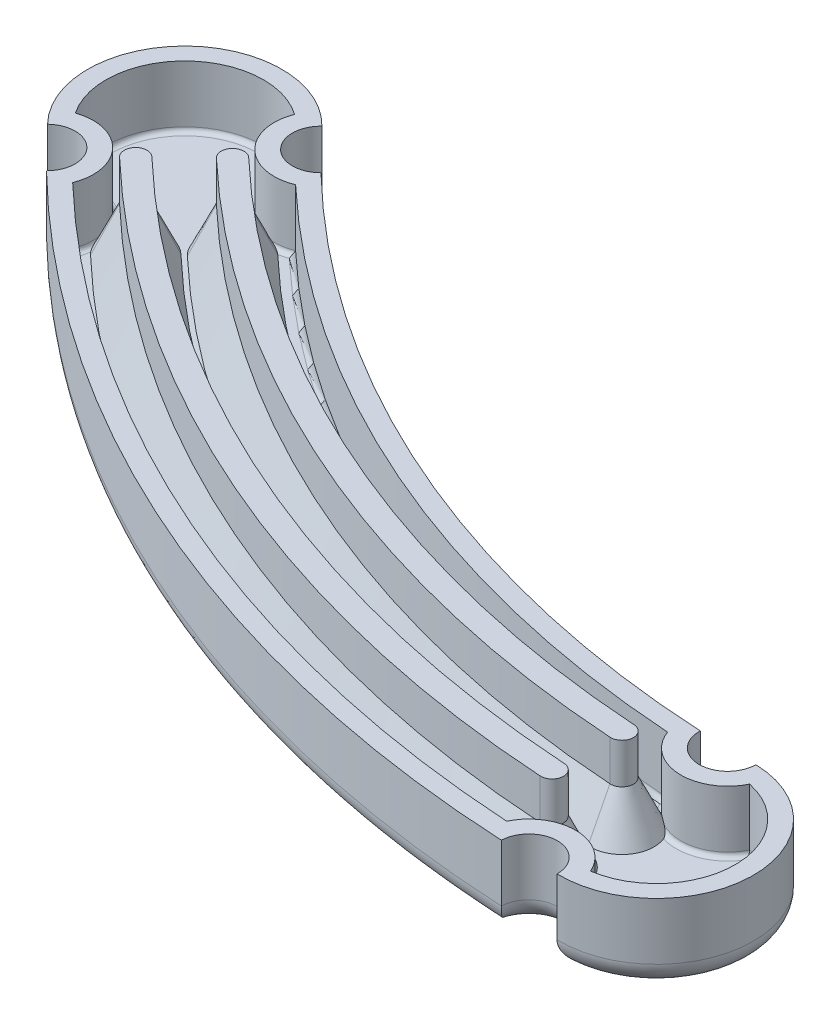
from build123d import *

# Parameters (mm, degrees)
BOSS_EXTRUDE1_DEPTH = 7
FILLET1_R           = 2
SHELL1_T            = -1.6
BOSS_EXTRUDE2_DEPTH = 7.4
CHAMFER1_SIZE       = 1.8
CHAMFER1_SIZE_2     = 3.860112457


with BuildPart() as part:
    # Sketch1 → Boss-Extrude1 (new body)
    with BuildSketch(Plane(origin=(0, 0, 0), x_dir=(1, 0, 0), z_dir=(0, 1, 0))):
        with BuildLine():
            ThreePointArc((-0.208151075, -108.497450978), (8.497338934, -100.212675907), (0.217200678, -91.50277552))
            ThreePointArc((0.217200678, -91.50277552), (-2.346486536, -93.970707759), (-4.780740732, -91.375021303))
            ThreePointArc((-4.780740732, -91.375021303), (-36.6, -83.861135218), (-63.746368582, -65.640311491))
            ThreePointArc((-63.746368582, -65.640311491), (-67.304850182, -65.620553623), (-67.23863968, -62.062633186))
            ThreePointArc((-67.23863968, -62.062633186), (-79.255338145, -61.914267797), (-79.41010236, -73.930885555))
            ThreePointArc((-79.41010236, -73.930885555), (-75.896472672, -73.998145219), (-75.921596958, -77.512328796))
            ThreePointArc((-75.921596958, -77.512328796), (-43.4, -99.441892581), (-5.206292309, -108.375017972))
            ThreePointArc((-5.206292309, -108.375017972), (-2.646734863, -105.966951709), (-0.208151075, -108.497450978))
        make_face()
    extrude(amount=BOSS_EXTRUDE1_DEPTH)

    # Fillet1
    fillet1_edges = [part.edges().sort_by_distance(p)[0] for p in [
        (8.497338934, 0, 100.212675907),
        (-2.646734863, 0, 105.966951709),
        (-43.4, 0, 99.441892581),
        (-75.896472672, 0, 73.998145219),
        (-79.255338145, 0, 61.914267797),
        (-67.304850182, 0, 65.620553623),
        (-36.6, 0, 83.861135218),
        (-2.346486536, 0, 93.970707759),
    ]]
    fillet(fillet1_edges, radius=FILLET1_R)

    # Shell1
    shell1_openings = [part.faces().sort_by_distance(p)[0] for p in [
        (-38.608785409, 7, 88.463840813),
    ]]
    offset(amount=SHELL1_T, openings=shell1_openings)

    # Sketch2 → Boss-Extrude2 (add)
    with BuildSketch(Plane(origin=(0, 1.6, 0), x_dir=(1, 0, 0), z_dir=(0, 1, 0))):
        with BuildLine():
            ThreePointArc((-71.760827467, -75.271237544), (-41.598799137, -95.314822932), (-6.392420314, -103.800349338))
            ThreePointArc((-6.392420314, -103.800349338), (-5.332843865, -102.863707598), (-6.269485606, -101.804131149))
            ThreePointArc((-6.269485606, -101.804131149), (-40.798799137, -93.481792654), (-70.380771716, -73.823671958))
            ThreePointArc((-70.380771716, -73.823671958), (-71.794582385, -73.857426876), (-71.760827467, -75.271237544))
        make_face()
        with BuildLine():
            ThreePointArc((-67.444921586, -71.102995809), (-39.200925419, -89.820604023), (-6.271030991, -97.801470495))
            ThreePointArc((-6.271030991, -97.801470495), (-5.20909176, -96.867508467), (-6.143053788, -95.805569236))
            ThreePointArc((-6.143053788, -95.805569236), (-38.400925419, -87.987573745), (-66.068527108, -69.651948518))
            ThreePointArc((-66.068527108, -69.651948518), (-67.482247993, -69.689274925), (-67.444921586, -71.102995809))
        make_face()
    extrude(amount=BOSS_EXTRUDE2_DEPTH)

    # Chamfer1
    # the kernel refuses this chamfer: 3.860112457, 1.8 mm, written as the material it adds along each edge
    with BuildSketch(Plane(origin=(-71.070799592, 1.6, 74.547454751), x_dir=(0.6900278753814706, 0, -0.7237827928298196), z_dir=(0.7237827928298196, 0, 0.6900278753814706))) as chamfer1_piece_1:
        Polygon((1 + CHAMFER1_SIZE, 0), (1, CHAMFER1_SIZE_2), (1, 0), align=None)
    revolve(axis=Axis((-71.070799592, 1.6, 74.547454751), (0, 1, 0)), revolution_arc=180)
    with BuildSketch(Plane(origin=(0, 1.6, 0), x_dir=(-0.6900278753814952, 0, 0.7237827928297962), z_dir=(-0.7237827928297962, 0, -0.6900278753814952))) as chamfer1_piece_2:
        Polygon((103.996997842 + CHAMFER1_SIZE, 0), (103.996997842, CHAMFER1_SIZE_2), (103.996997842, 0), align=None)
    revolve(axis=Axis((0, 1.6, 0), (0, 1, 0)), revolution_arc=40.108274016)
    with BuildSketch(Plane(origin=(-6.33095296, 1.6, 102.802240244), x_dir=(-0.06146735431647071, 0, 0.9981090944147004), z_dir=(-0.9981090944147004, 0, -0.06146735431647071))) as chamfer1_piece_3:
        Polygon((1 + CHAMFER1_SIZE, 0), (1, CHAMFER1_SIZE_2), (1, 0), align=None)
    revolve(axis=Axis((-6.33095296, 1.6, 102.802240244), (0, 1, 0)), revolution_arc=180)
    with BuildSketch(Plane(origin=(0, 1.6, 0), x_dir=(-0.061467354316436545, 0, 0.9981090944147026), z_dir=(0.9981090944147026, 0, 0.061467354316436545))) as chamfer1_piece_4:
        Polygon((101.996997842 - CHAMFER1_SIZE, 0), (101.996997842, -CHAMFER1_SIZE_2), (101.996997842, 0), align=None)
    revolve(axis=Axis((0, 1.6, 0), (0, -1, 0)), revolution_arc=40.108274016)
    with BuildSketch(Plane(origin=(-66.756724347, 1.6, 70.377472163), x_dir=(0.6881972388632951, 0, -0.7255236456663123), z_dir=(0.7255236456663123, 0, 0.6881972388632951))) as chamfer1_piece_5:
        Polygon((1 + CHAMFER1_SIZE, 0), (1, CHAMFER1_SIZE_2), (1, 0), align=None)
    revolve(axis=Axis((-66.756724347, 1.6, 70.377472163), (0, 1, 0)), revolution_arc=180)
    with BuildSketch(Plane(origin=(0, 1.6, 0), x_dir=(-0.6881972388633303, 0, 0.7255236456662789), z_dir=(-0.7255236456662789, 0, -0.6881972388633303))) as chamfer1_piece_6:
        Polygon((98.002313548 + CHAMFER1_SIZE, 0), (98.002313548, CHAMFER1_SIZE_2), (98.002313548, 0), align=None)
    revolve(axis=Axis((0, 1.6, 0), (0, 1, 0)), revolution_arc=39.818790197)
    with BuildSketch(Plane(origin=(-6.207042389, 1.6, 96.803519866), x_dir=(-0.06398860153237831, 0, 0.9979506294771955), z_dir=(-0.9979506294771955, 0, -0.06398860153237831))) as chamfer1_piece_7:
        Polygon((1 + CHAMFER1_SIZE, 0), (1, CHAMFER1_SIZE_2), (1, 0), align=None)
    revolve(axis=Axis((-6.207042389, 1.6, 96.803519866), (0, 1, 0)), revolution_arc=180)
    with BuildSketch(Plane(origin=(0, 1.6, 0), x_dir=(-0.0639886015323043, 0, 0.9979506294772001), z_dir=(0.9979506294772001, 0, 0.0639886015323043))) as chamfer1_piece_8:
        Polygon((96.002313548 - CHAMFER1_SIZE, 0), (96.002313548, -CHAMFER1_SIZE_2), (96.002313548, 0), align=None)
    revolve(axis=Axis((0, 1.6, 0), (0, -1, 0)), revolution_arc=39.818790197)


solid = part.part
